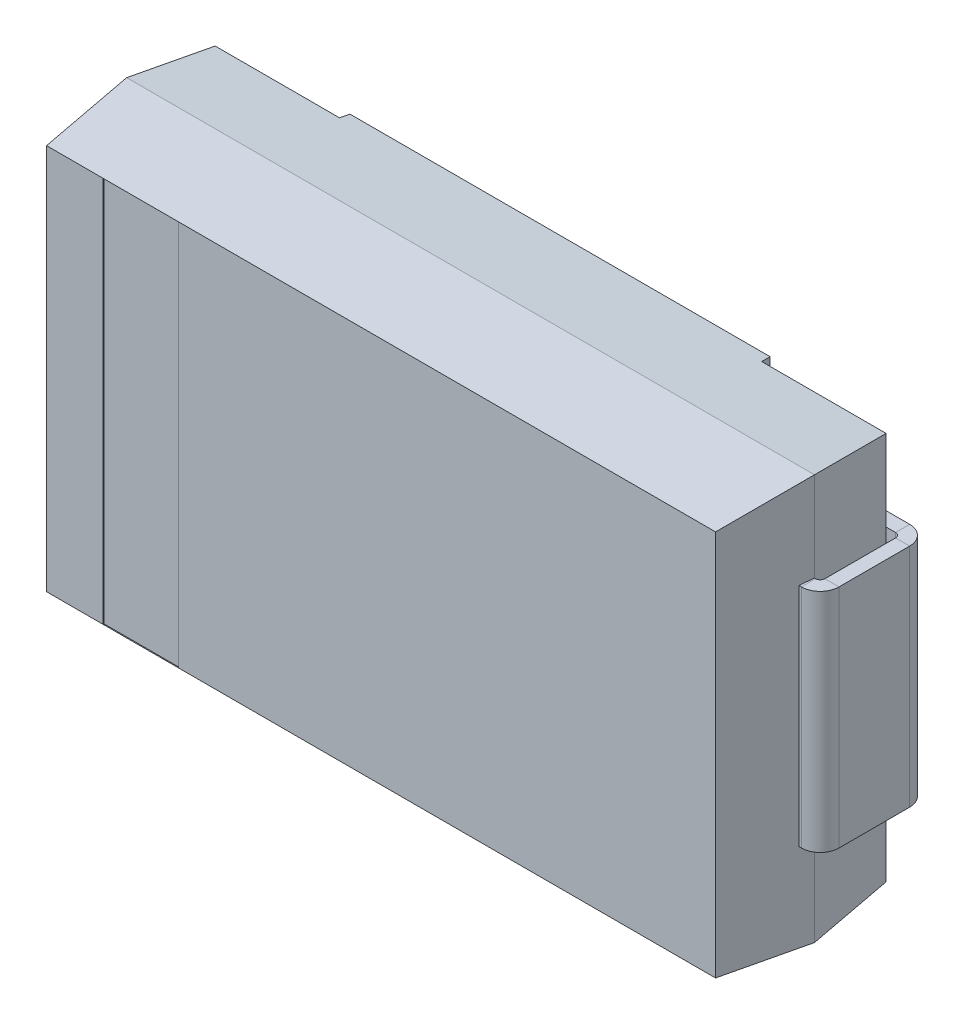
from build123d import *

# Parameters (mm, degrees)
SKETCH_1_W                  = 7.3
SKETCH_1_H                  = 4.3
EXTRUDE_1_DEPTH             = 0.95
EXTRUDE_1_TAPER             = 6
EXTRUDE_1_OTHER_WAY_DEPTH   = 0.85
EXTRUDE_1_OTHER_WAY_TAPER   = 6
SM_BASE_FLANGE_1_DEPTH      = 1.2
SM_BASE_FLANGE_1_DEPTH_BACK = 1.2
SKETCH_10_W                 = 4.48
SKETCH_10_H                 = 4.1213228
EXTRUDE_2_DEPTH             = 0.1
EXTRUDE_2_TAPER             = 6
SKETCH_12_W                 = 0.8
SKETCH_12_H                 = 4.100301952
CUT_EXTRUDE_1_DEPTH         = 0.01


# Sheet-metal steps are written as plain solids
with BuildPart() as part:
    # Sketch 1 → Бобышка-Вытянуть1 (new body)
    with BuildSketch(Plane.XY.offset(1)):
        Rectangle(SKETCH_1_W, SKETCH_1_H)
    extrude(amount=EXTRUDE_1_DEPTH, taper=EXTRUDE_1_TAPER)

    # Sketch 1 → Бобышка-Вытянуть1 other way (add)
    with BuildSketch(Plane.XY.offset(1)):
        Rectangle(SKETCH_1_W, SKETCH_1_H)
    extrude(amount=-EXTRUDE_1_OTHER_WAY_DEPTH, taper=EXTRUDE_1_OTHER_WAY_TAPER)

    # Эскиз10 → Бобышка-Вытянуть2 (add)
    with BuildSketch(Plane(origin=(0, 0, 0.15), x_dir=(-1, 0, 0), z_dir=(0, 0, -1))):
        Rectangle(SKETCH_10_W, SKETCH_10_H)
    extrude(amount=EXTRUDE_2_DEPTH, taper=EXTRUDE_2_TAPER)

    # Эскиз12 → Вырез-Вытянуть1 (cut)
    with BuildSketch(Plane.XY.offset(1.95)):
        with Locations((-2.550150976, 0)):
            Rectangle(SKETCH_12_W, SKETCH_12_H)
    extrude(amount=-CUT_EXTRUDE_1_DEPTH, mode=Mode.SUBTRACT)


with BuildPart() as body_2:
    # Sketch 3 → Базовая кромка1 (new, two sides: drawn at the far end of the back side and taken through both)
    with BuildSketch(Plane(origin=(0, 0, 0), x_dir=(1, 0, 0), z_dir=(0, 1, 0)).offset(-SM_BASE_FLANGE_1_DEPTH_BACK)):
        with BuildLine():
            Line((-3.303882397, -1), (-3.6606614, -1))
            ThreePointArc((-3.6606614, -1), (-3.696016739, -0.985355339), (-3.7106614, -0.95))
            Line((-3.7106614, -0.95), (-3.7106614, -0.2))
            ThreePointArc((-3.7106614, -0.2), (-3.696016739, -0.164644661), (-3.6606614, -0.15))
            Line((-3.6606614, -0.15), (-2.4106614, -0.15))
            Line((-2.4106614, -0.15), (-2.4106614, 0))
            Line((-2.4106614, 0), (-3.6606614, 0))
            ThreePointArc((-3.6606614, 0), (-3.802082756, -0.058578644), (-3.8606614, -0.2))
            Line((-3.8606614, -0.2), (-3.8606614, -0.95))
            ThreePointArc((-3.8606614, -0.95), (-3.802082756, -1.091421356), (-3.6606614, -1.15))
            Line((-3.6606614, -1.15), (-3.303882397, -1.15))
            Line((-3.303882397, -1.15), (-3.303882397, -1))
        make_face()
    extrude(amount=SM_BASE_FLANGE_1_DEPTH + SM_BASE_FLANGE_1_DEPTH_BACK)


with BuildPart() as body_3:
    # Зеркальное отражение1: mirrored copy
    add(body_2.part.mirror(Plane(origin=(0, 0, 0), x_dir=(0, 0, 1), z_dir=(1, 0, 0))))


solid = Compound([part.part, body_2.part, body_3.part])
